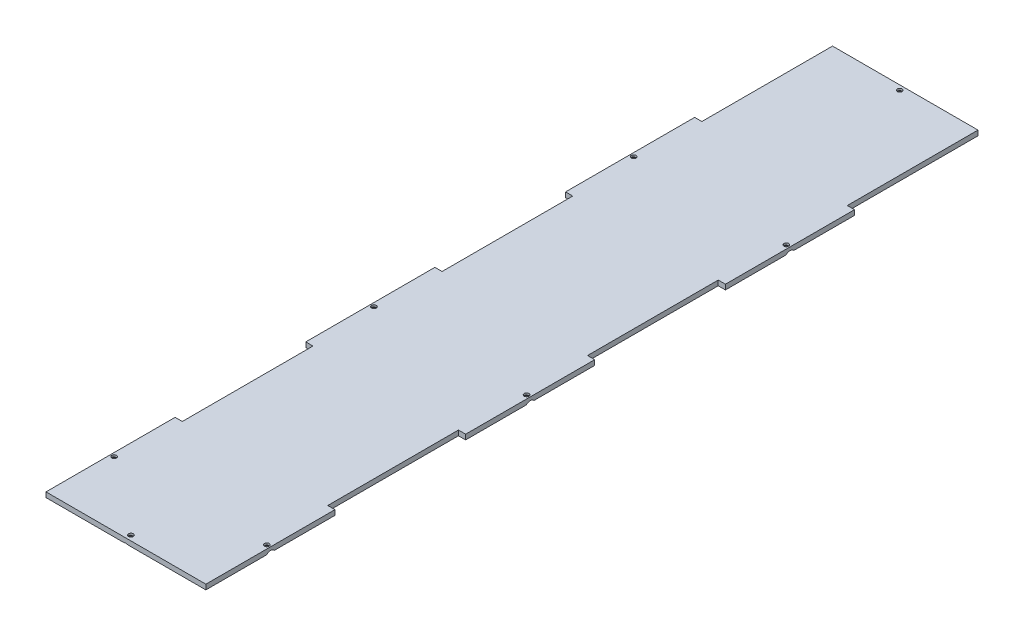
from build123d import *

# Parameters (mm, degrees)
SKETCH1_R           = 1.524
BOSS_EXTRUDE1_DEPTH = 3.175
SKETCH2_R           = 1.524
CUT_EXTRUDE1_DEPTH  = 12.7
CHAMFER1_SIZE       = 1.905


with BuildPart() as part:
    # Sketch1 → Boss-Extrude1 (new body)
    with BuildSketch(Plane(origin=(0, 0, 0), x_dir=(1, 0, 0), z_dir=(0, 1, 0))):
        Polygon((-116.742050037, 65.586269915), (-116.742050037, -16.455730085), (-121.314050037, -16.455730085), (-121.314050037, -99.513730085), (-116.742050037, -99.513730085), (-116.742050037, -181.555730085), (-121.314050037, -181.555730085), (-213.770050037, -181.555730085), (-218.342050037, -181.555730085), (-218.342050037, -99.513730085), (-213.770050037, -99.513730085), (-213.770050037, -16.455730085), (-218.342050037, -16.455730085), (-218.342050037, 65.586269915), (-213.770050037, 65.586269915), (-213.770050037, 148.644269915), (-218.342050037, 148.644269915), (-218.342050037, 230.686269915), (-213.770050037, 230.686269915), (-213.770050037, 307.394269915), (-213.770050037, 313.744269915), (-121.314050037, 313.744269915), (-121.314050037, 307.394269915), (-121.314050037, 230.686269915), (-116.742050037, 230.686269915), (-116.742050037, 148.644269915), (-121.314050037, 148.644269915), (-121.314050037, 65.586269915), align=None)
        with Locations(Location((-119.028050037, 189.665269915, 0), (0, 0, 270))):
            Circle(SKETCH1_R, mode=Mode.SUBTRACT)
        with Locations(Location((-119.028050037, 24.565269915, 0), (0, 0, 270))):
            Circle(SKETCH1_R, mode=Mode.SUBTRACT)
        with Locations(Location((-119.028050037, -140.534730085, 0), (0, 0, 270))):
            Circle(SKETCH1_R, mode=Mode.SUBTRACT)
        with Locations(Location((-216.056050037, 189.665269915, 0), (0, 0, 90))):
            Circle(SKETCH1_R, mode=Mode.SUBTRACT)
        with Locations(Location((-216.056050037, 24.565269915, 0), (0, 0, 90))):
            Circle(SKETCH1_R, mode=Mode.SUBTRACT)
        with Locations(Location((-216.056050037, -140.534730085, 0), (0, 0, 90))):
            Circle(SKETCH1_R, mode=Mode.SUBTRACT)
        with Locations(Location((-167.542050037, -178.380730085, 0), (0, 0, 270))):
            Circle(SKETCH1_R, mode=Mode.SUBTRACT)
    extrude(amount=BOSS_EXTRUDE1_DEPTH)

    # Sketch2 → Cut-Extrude1 (cut)
    with BuildSketch(Plane.XZ):
        with Locations(Location((-168.088150037, -310.823269915, 0), (0, 0, 270))):
            Circle(SKETCH2_R)
    extrude(amount=-CUT_EXTRUDE1_DEPTH, mode=Mode.SUBTRACT)

    # Chamfer1
    # the kernel refuses this chamfer: 1.905 mm, written as the material it takes off along each edge
    with BuildSketch(Plane(origin=(-168.088150037, 0, -310.823269915), x_dir=(0, 0, -1), z_dir=(-1, 0, 0))) as chamfer1_piece_1:
        Polygon((1.524 + CHAMFER1_SIZE, 0), (1.524, -CHAMFER1_SIZE), (1.524, 0), align=None)
    revolve(axis=Axis((-168.088150037, 0, -310.823269915), (0, -1, 0)), mode=Mode.SUBTRACT)
    with BuildSketch(Plane(origin=(-119.028050037, 0, -189.665269915), x_dir=(0, 0, 1), z_dir=(-1, 0, 0))) as chamfer1_piece_2:
        Polygon((1.524 + CHAMFER1_SIZE, 0), (1.524, CHAMFER1_SIZE), (1.524, 0), align=None)
    revolve(axis=Axis((-119.028050037, 0, -189.665269915), (0, 1, 0)), mode=Mode.SUBTRACT)
    with BuildSketch(Plane(origin=(-119.028050037, 0, -24.565269915), x_dir=(0, 0, 1), z_dir=(-1, 0, 0))) as chamfer1_piece_3:
        Polygon((1.524 + CHAMFER1_SIZE, 0), (1.524, CHAMFER1_SIZE), (1.524, 0), align=None)
    revolve(axis=Axis((-119.028050037, 0, -24.565269915), (0, 1, 0)), mode=Mode.SUBTRACT)
    with BuildSketch(Plane(origin=(-216.056050037, 0, -189.665269915), x_dir=(0, 0, -1), z_dir=(1, 0, 0))) as chamfer1_piece_4:
        Polygon((1.524 + CHAMFER1_SIZE, 0), (1.524, CHAMFER1_SIZE), (1.524, 0), align=None)
    revolve(axis=Axis((-216.056050037, 0, -189.665269915), (0, 1, 0)), mode=Mode.SUBTRACT)
    with BuildSketch(Plane(origin=(-119.028050037, 0, 140.534730085), x_dir=(0, 0, 1), z_dir=(-1, 0, 0))) as chamfer1_piece_5:
        Polygon((1.524 + CHAMFER1_SIZE, 0), (1.524, CHAMFER1_SIZE), (1.524, 0), align=None)
    revolve(axis=Axis((-119.028050037, 0, 140.534730085), (0, 1, 0)), mode=Mode.SUBTRACT)
    with BuildSketch(Plane(origin=(-216.056050037, 0, -24.565269915), x_dir=(0, 0, -1), z_dir=(1, 0, 0))) as chamfer1_piece_6:
        Polygon((1.524 + CHAMFER1_SIZE, 0), (1.524, CHAMFER1_SIZE), (1.524, 0), align=None)
    revolve(axis=Axis((-216.056050037, 0, -24.565269915), (0, 1, 0)), mode=Mode.SUBTRACT)
    with BuildSketch(Plane(origin=(-216.056050037, 0, 140.534730085), x_dir=(0, 0, -1), z_dir=(1, 0, 0))) as chamfer1_piece_7:
        Polygon((1.524 + CHAMFER1_SIZE, 0), (1.524, CHAMFER1_SIZE), (1.524, 0), align=None)
    revolve(axis=Axis((-216.056050037, 0, 140.534730085), (0, 1, 0)), mode=Mode.SUBTRACT)
    with BuildSketch(Plane(origin=(-167.542050037, 0, 178.380730085), x_dir=(0, 0, 1), z_dir=(-1, 0, 0))) as chamfer1_piece_8:
        Polygon((1.524 + CHAMFER1_SIZE, 0), (1.524, CHAMFER1_SIZE), (1.524, 0), align=None)
    revolve(axis=Axis((-167.542050037, 0, 178.380730085), (0, 1, 0)), mode=Mode.SUBTRACT)


solid = part.part
